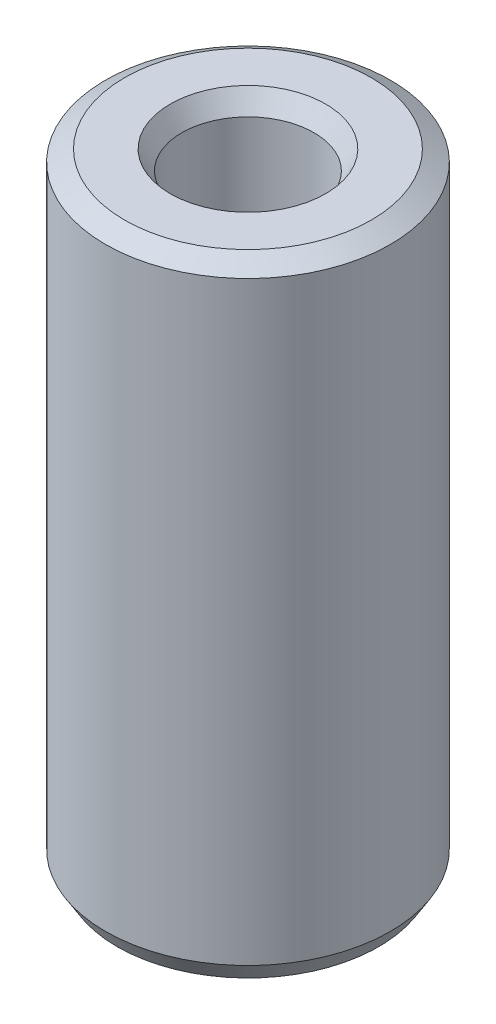
from build123d import *
from OCP.BRepFilletAPI import BRepFilletAPI_MakeChamfer

# Parameters (mm, degrees)
SKETCH1_R           = 47.5
BOSS_EXTRUDE1_DEPTH = 208.672763041
SKETCH2_R           = 22.051809353
CUT_EXTRUDE1_DEPTH  = 220.218662607
CHAMFER1_SIZE       = 3.869946915
CHAMFER1_SIZE2      = 6.347649026


with BuildPart() as part:
    # Sketch1 → Boss-Extrude1 (new body)
    with BuildSketch(Plane(origin=(0, 0, 0), x_dir=(1, 0, 0), z_dir=(0, 1, 0))):
        Circle(SKETCH1_R)
    extrude(amount=BOSS_EXTRUDE1_DEPTH)

    # Sketch2 → Cut-Extrude1 (cut, through all)
    with BuildSketch(Plane(origin=(0, 0, 0), x_dir=(1, 0, 0), z_dir=(0, 1, 0))):
        Circle(SKETCH2_R)
    extrude(amount=CUT_EXTRUDE1_DEPTH, mode=Mode.SUBTRACT)

    # Chamfer1: one chamfer whose edges measure the first distance from different faces: ONE call of the kernel's chamfer builder (chamfer() names one face for all edges)
    chamfer1_edges_1 = [part.edges().sort_by_distance(p)[0] for p in [
        (-22.051809353, 208.672763041, 0),
    ]]
    chamfer1_side_1 = [part.faces().sort_by_distance(p)[0] for p in [
        (-46.156497116, 208.672763041, 0),
    ]]
    chamfer1_edges_2 = [part.edges().sort_by_distance(p)[0] for p in [
        (-22.051809353, 0, 0),
    ]]
    chamfer1_side_2 = [part.faces().sort_by_distance(p)[0] for p in [
        (-22.051809353, 104.33638152, 0),
    ]]
    chamfer1_edges_3 = [part.edges().sort_by_distance(p)[0] for p in [
        (-47.5, 0, 0),
    ]]
    chamfer1_side_3 = [part.faces().sort_by_distance(p)[0] for p in [
        (-46.156497116, 0, 0),
    ]]
    chamfer1_edges_4 = [part.edges().sort_by_distance(p)[0] for p in [
        (-47.5, 208.672763041, 0),
    ]]
    chamfer1_side_4 = [part.faces().sort_by_distance(p)[0] for p in [
        (-47.5, 104.33638152, 0),
    ]]
    chamfer1 = BRepFilletAPI_MakeChamfer(part.part.solid().wrapped)
    for e in chamfer1_edges_1:
        chamfer1.Add(CHAMFER1_SIZE, CHAMFER1_SIZE2, e.wrapped, chamfer1_side_1[0].wrapped)  # the first distance lies on this face
    for e in chamfer1_edges_2:
        chamfer1.Add(CHAMFER1_SIZE, CHAMFER1_SIZE2, e.wrapped, chamfer1_side_2[0].wrapped)  # the first distance lies on this face
    for e in chamfer1_edges_3:
        chamfer1.Add(CHAMFER1_SIZE, CHAMFER1_SIZE2, e.wrapped, chamfer1_side_3[0].wrapped)  # the first distance lies on this face
    for e in chamfer1_edges_4:
        chamfer1.Add(CHAMFER1_SIZE, CHAMFER1_SIZE2, e.wrapped, chamfer1_side_4[0].wrapped)  # the first distance lies on this face
    add(Compound.cast(chamfer1.Shape()), mode=Mode.REPLACE)


solid = part.part
